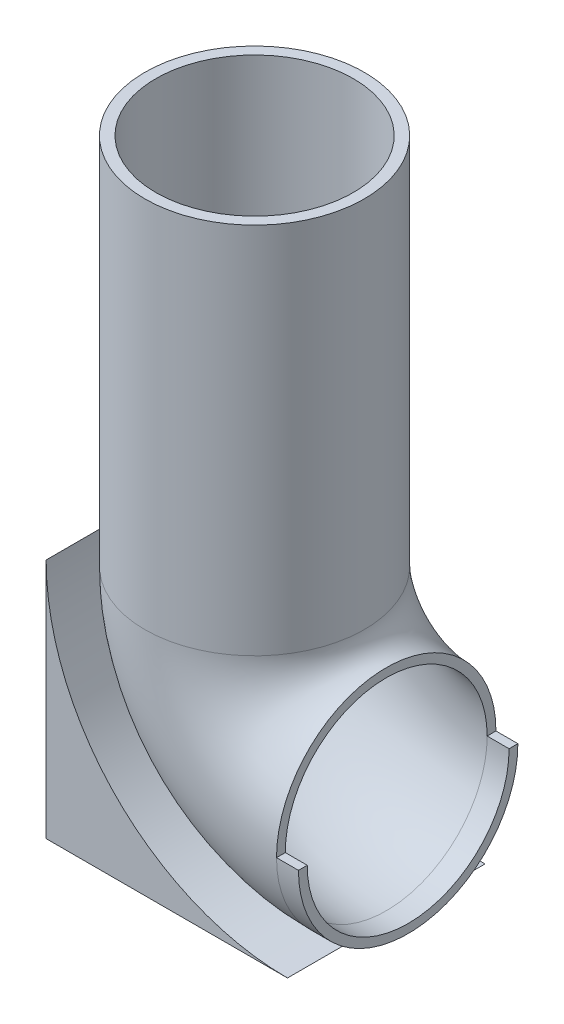
from build123d import *

# Parameters (mm, degrees)
SKETCH2_R               = 25
SKETCH2_R_2             = 22.5
BOSS_EXTRUDE1_DEPTH     = 85
SKETCH3_R               = 25
REVOLVE1_ANGLE          = 90
SKETCH4_R               = 25
BOSS_EXTRUDE2_DEPTH     = 5
VACIADO1_T              = -2
CORTAR_EXTRUIR1_DEPTH   = 5
SALIENTE_EXTRUIR2_DEPTH = 22.5
CROQUIS3_R              = 4
CORTAR_EXTRUIR2_DEPTH   = 6
CORTAR_EXTRUIR3_START   = -2
CROQUIS4_R              = 22.5
CORTAR_EXTRUIR3_DEPTH   = 2


with BuildPart() as part:
    # Sketch2 → Boss-Extrude1 (new body)
    with BuildSketch(Plane(origin=(0, 0, 0), x_dir=(1, 0, 0), z_dir=(0, 1, 0))):
        Circle(SKETCH2_R)
        Circle(SKETCH2_R_2, mode=Mode.SUBTRACT)
    extrude(amount=BOSS_EXTRUDE1_DEPTH)

    # Sketch3 → Revolve1 (revolve)
    with BuildSketch(Plane(origin=(0, 0, 0), x_dir=(1, 0, 0), z_dir=(0, 1, 0))):
        Circle(SKETCH3_R)
    revolve(axis=Axis((30, 0, -21.726770061), (0, 0, 1)), revolution_arc=REVOLVE1_ANGLE)

    # Sketch4 → Boss-Extrude2 (add)
    with BuildSketch(Plane(origin=(30, 0, 0), x_dir=(0, 0, -1), z_dir=(1, 0, 0))):
        with Locations((0, -30)):
            Circle(SKETCH4_R)
    extrude(amount=BOSS_EXTRUDE2_DEPTH)

    # Vaciado1
    vaciado1_openings = [part.faces().sort_by_distance(p)[0] for p in [
        (35, -30, 0),
    ]]
    offset(amount=VACIADO1_T, openings=vaciado1_openings, kind=Kind.INTERSECTION)

    # Croquis1 → Cortar-Extruir1 (cut)
    with BuildSketch(Plane(origin=(35, 0, 0), x_dir=(0, 0, -1), z_dir=(1, 0, 0))):
        with BuildLine():
            Line((-25, -30), (25, -30))
            ThreePointArc((25, -30), (0, 0.962643483), (-25, -30))
        make_face()
    extrude(amount=-CORTAR_EXTRUIR1_DEPTH, mode=Mode.SUBTRACT)

    # Croquis4 → Cortar-Extruir3 (cut)
    with BuildSketch(Plane(origin=(0, 0, 0), x_dir=(1, 0, 0), z_dir=(0, 1, 0)).offset(CORTAR_EXTRUIR3_START)):
        Circle(CROQUIS4_R)
    extrude(amount=CORTAR_EXTRUIR3_DEPTH, mode=Mode.SUBTRACT)


with BuildPart() as body_2:
    # Croquis3D2 → Saliente-Extruir2 (new, symmetric)
    with BuildSketch(Plane(origin=(-25, 0, 0), x_dir=(0.7071067811865489, -0.7071067811865462, 0), z_dir=(0, 0, -1))):
        with BuildLine():
            Line((0, 0), (38.890872965, 38.890872965))
            Line((38.890872965, 38.890872965), (77.781745931, 0))
            ThreePointArc((77.781745931, 0), (38.890872965, 16.109127035), (0, 0))
        make_face()
    extrude(amount=SALIENTE_EXTRUIR2_DEPTH, both=True)

    # Croquis3 → Cortar-Extruir2 (cut)
    with BuildSketch(Plane(origin=(0, -55, 0), x_dir=(-1, 0, 0), z_dir=(0, -1, 0))):
        with Locations((10, -15)):
            Circle(CROQUIS3_R)
        with Locations((10, 15)):
            Circle(CROQUIS3_R)
    extrude(amount=-CORTAR_EXTRUIR2_DEPTH, mode=Mode.SUBTRACT)


solid = Compound([part.part, body_2.part])
